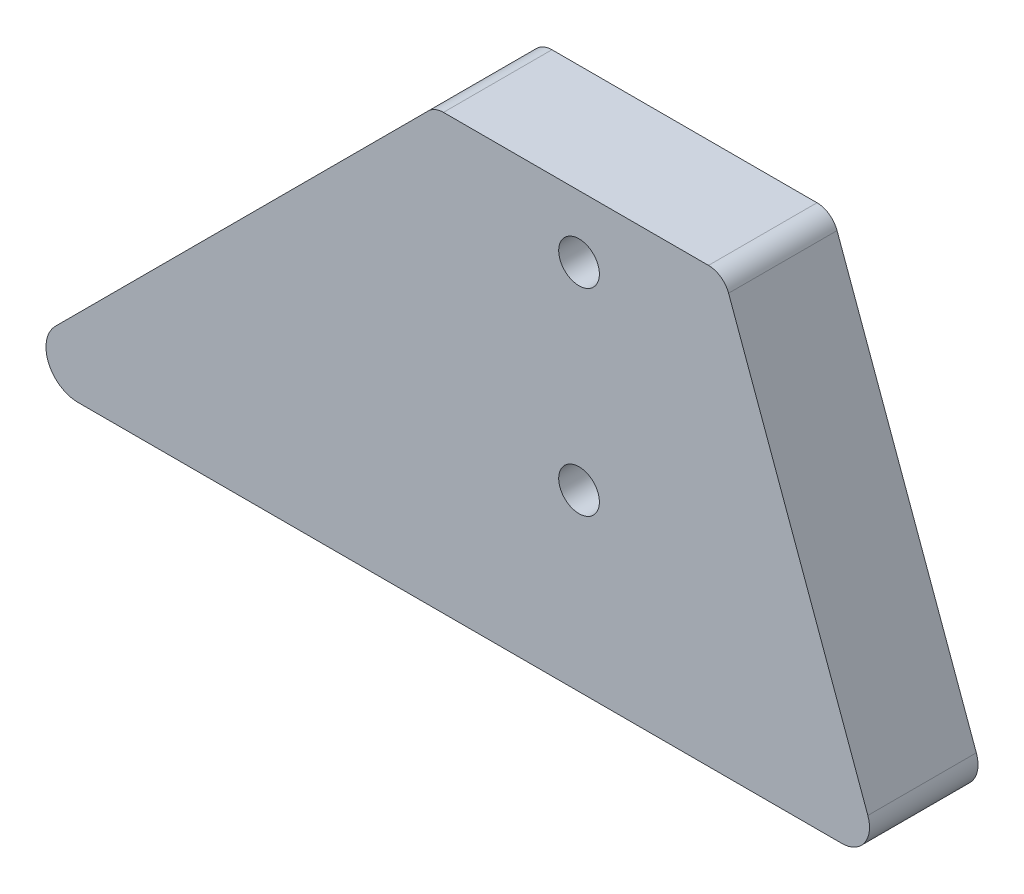
from build123d import *

# Parameters (mm, degrees)
BOSS_EXTRUDE1_DEPTH      = 12.7
BOSS_EXTRUDE1_DEPTH_BACK = 12.7
SKETCH1_R                = 4.7625


with BuildPart() as part:
    # Sketch1 → Boss-Extrude1 (new, two sides: drawn at the far end of the back side and taken through both)
    with BuildSketch(Plane.XY.offset(-BOSS_EXTRUDE1_DEPTH_BACK)):
        with BuildLine():
            Line((-14.2875, -65.862), (47.221413758, -65.862))
            ThreePointArc((47.221413758, -65.862), (52.545902046, -63.090246836), (53.329415793, -57.138869068))
            Line((53.329415793, -57.138869068), (20.722425413, 32.448100717))
            ThreePointArc((20.722425413, 32.448100717), (18.891844491, 34.833760221), (16.023962309, 35.738))
            Line((16.023962309, 35.738), (-46.028932188, 35.738))
            ThreePointArc((-46.028932188, 35.738), (-47.94234935, 35.357397663), (-49.564466094, 34.273533906))
            Line((-49.564466094, 34.273533906), (-136.896699141, -53.058699141))
            ThreePointArc((-136.896699141, -53.058699141), (-138.522494776, -61.232125743), (-131.593398282, -65.862))
            Line((-131.593398282, -65.862), (-14.2875, -65.862))
        make_face()
        with BuildLine():
            ThreePointArc((-9.525, -25), (-10.919903955, -28.367596045), (-14.2875, -29.7625))
            ThreePointArc((-14.2875, -29.7625), (-19.05, -25), (-14.2875, -20.2375))
            ThreePointArc((-14.2875, -20.2375), (-10.919903955, -21.632403955), (-9.525, -25))
        make_face(mode=Mode.SUBTRACT)
        with Locations((-14.2875, 21.21)):
            Circle(SKETCH1_R, mode=Mode.SUBTRACT)
    extrude(amount=BOSS_EXTRUDE1_DEPTH + BOSS_EXTRUDE1_DEPTH_BACK)


solid = part.part
